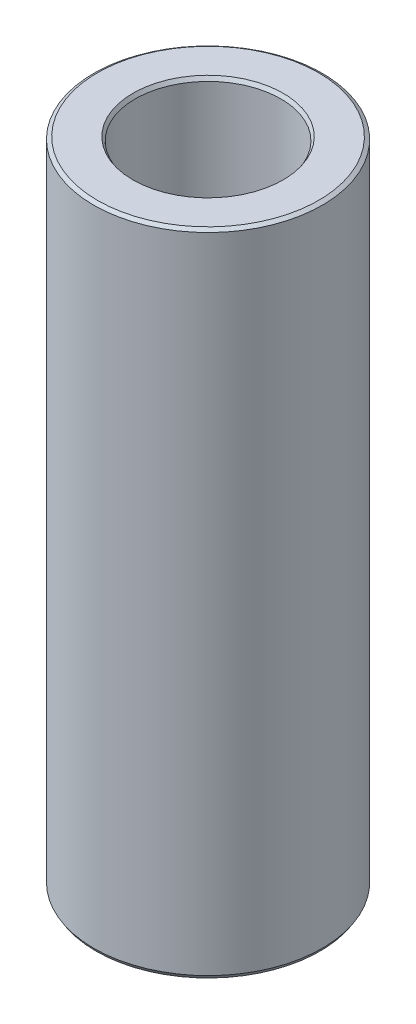
from build123d import *
from OCP.BRepFilletAPI import BRepFilletAPI_MakeChamfer

# Parameters (mm, degrees)
SKETCH1_R           = 22.5
BOSS_EXTRUDE1_DEPTH = 127.889407203
SKETCH2_R           = 14.332224307
CUT_EXTRUDE1_DEPTH  = 132.788468671
CHAMFER1_SIZE       = 0.458189876
CHAMFER1_SIZE2      = 0.729408994


with BuildPart() as part:
    # Sketch1 → Boss-Extrude1 (new body)
    with BuildSketch(Plane(origin=(0, 0, 0), x_dir=(1, 0, 0), z_dir=(0, 1, 0))):
        Circle(SKETCH1_R)
    extrude(amount=BOSS_EXTRUDE1_DEPTH)

    # Sketch2 → Cut-Extrude1 (cut, through all)
    with BuildSketch(Plane(origin=(0, 0, 0), x_dir=(1, 0, 0), z_dir=(0, 1, 0))):
        Circle(SKETCH2_R)
    extrude(amount=CUT_EXTRUDE1_DEPTH, mode=Mode.SUBTRACT)

    # Chamfer1: one chamfer whose edges measure the first distance from different faces: ONE call of the kernel's chamfer builder (chamfer() names one face for all edges)
    chamfer1_edges_1 = [part.edges().sort_by_distance(p)[0] for p in [
        (-14.332224307, 127.889407203, 0),
    ]]
    chamfer1_side_1 = [part.faces().sort_by_distance(p)[0] for p in [
        (-21.863603897, 127.889407203, 0),
    ]]
    chamfer1_edges_2 = [part.edges().sort_by_distance(p)[0] for p in [
        (-14.332224307, 0, 0),
    ]]
    chamfer1_side_2 = [part.faces().sort_by_distance(p)[0] for p in [
        (-14.332224307, 63.944703602, 0),
    ]]
    chamfer1_edges_3 = [part.edges().sort_by_distance(p)[0] for p in [
        (-22.5, 0, 0),
    ]]
    chamfer1_side_3 = [part.faces().sort_by_distance(p)[0] for p in [
        (-21.863603897, 0, 0),
    ]]
    chamfer1_edges_4 = [part.edges().sort_by_distance(p)[0] for p in [
        (-22.5, 127.889407203, 0),
    ]]
    chamfer1_side_4 = [part.faces().sort_by_distance(p)[0] for p in [
        (-22.5, 63.944703602, 0),
    ]]
    chamfer1 = BRepFilletAPI_MakeChamfer(part.part.solid().wrapped)
    for e in chamfer1_edges_1:
        chamfer1.Add(CHAMFER1_SIZE, CHAMFER1_SIZE2, e.wrapped, chamfer1_side_1[0].wrapped)  # the first distance lies on this face
    for e in chamfer1_edges_2:
        chamfer1.Add(CHAMFER1_SIZE, CHAMFER1_SIZE2, e.wrapped, chamfer1_side_2[0].wrapped)  # the first distance lies on this face
    for e in chamfer1_edges_3:
        chamfer1.Add(CHAMFER1_SIZE, CHAMFER1_SIZE2, e.wrapped, chamfer1_side_3[0].wrapped)  # the first distance lies on this face
    for e in chamfer1_edges_4:
        chamfer1.Add(CHAMFER1_SIZE, CHAMFER1_SIZE2, e.wrapped, chamfer1_side_4[0].wrapped)  # the first distance lies on this face
    add(Compound.cast(chamfer1.Shape()), mode=Mode.REPLACE)


solid = part.part
